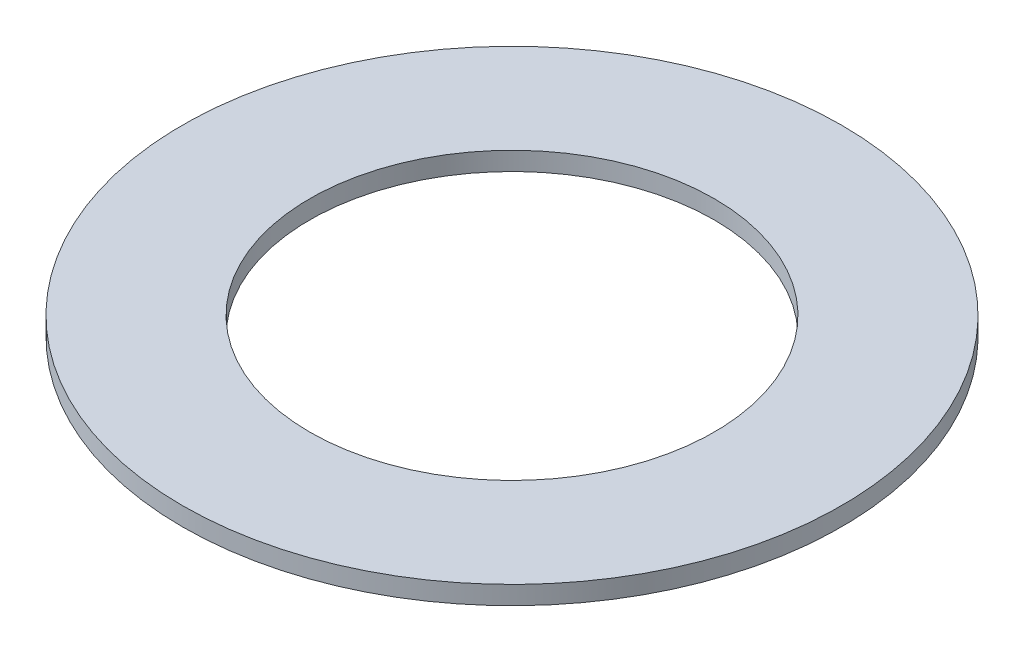
from build123d import *

# Parameters (mm, degrees)
SKETCH1_R           = 5.588
SKETCH1_R_2         = 3.429
BOSS_EXTRUDE1_DEPTH = 0.3125


with BuildPart() as part:
    # Sketch1 → Boss-Extrude1 (new body)
    with BuildSketch(Plane(origin=(0, 0, 0), x_dir=(1, 0, 0), z_dir=(0, 1, 0))):
        Circle(SKETCH1_R)
        Circle(SKETCH1_R_2, mode=Mode.SUBTRACT)
    extrude(amount=BOSS_EXTRUDE1_DEPTH)


solid = part.part
